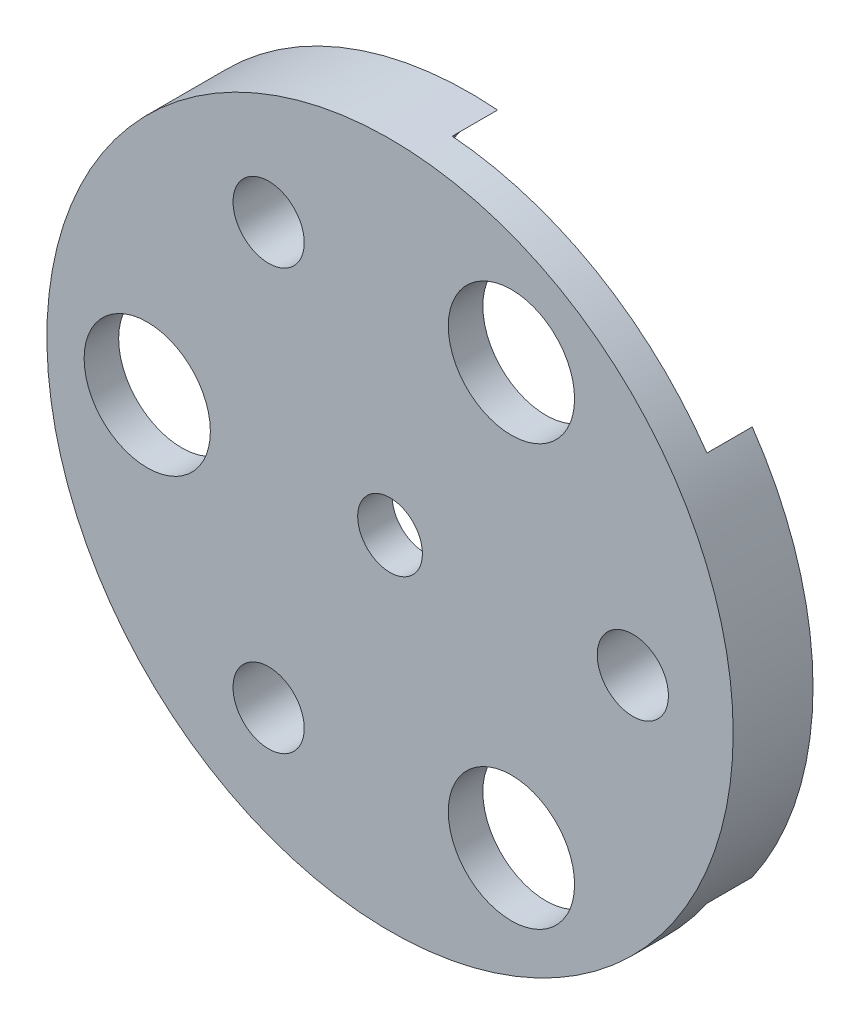
from build123d import *

# Parameters (mm, degrees)
SKETCH1_R           = 15.9
SKETCH1_R_2         = 1.65
SKETCH1_R_3         = 2.925
SKETCH1_R_4         = 1.5
BOSS_EXTRUDE1_DEPTH = 3.7
SKETCH2_R           = 2.925
CUT_EXTRUDE1_DEPTH  = 2.1


with BuildPart() as part:
    # Sketch1 → Boss-Extrude1 (new body)
    with BuildSketch(Plane.XY):
        with Locations((169.819947444, 173.617651357)):
            Circle(SKETCH1_R)
        with Locations((181.069947444, 173.617651357)):
            Circle(SKETCH1_R_2, mode=Mode.SUBTRACT)
        with Locations((158.569947444, 173.617651357)):
            Circle(SKETCH1_R_3, mode=Mode.SUBTRACT)
        with Locations((164.194947444, 163.874865564)):
            Circle(SKETCH1_R_2, mode=Mode.SUBTRACT)
        with Locations((164.194947444, 183.360437149)):
            Circle(SKETCH1_R_2, mode=Mode.SUBTRACT)
        with Locations((175.444947444, 183.360437149)):
            Circle(SKETCH1_R_3, mode=Mode.SUBTRACT)
        with Locations((175.444947444, 163.874865564)):
            Circle(SKETCH1_R_3, mode=Mode.SUBTRACT)
        with Locations((169.819947444, 173.617651357)):
            Circle(SKETCH1_R_4, mode=Mode.SUBTRACT)
    extrude(amount=BOSS_EXTRUDE1_DEPTH)

    # Sketch2 → Cut-Extrude1 (cut)
    with BuildSketch(Plane(origin=(0, 0, 0), x_dir=(-1, 0, 0), z_dir=(0, 0, -1))):
        with BuildLine():
            ThreePointArc((-155.453613863, 180.430760739), (-160.20419082, 180.929234156), (-164.29045907, 178.45559939))
            ThreePointArc((-164.29045907, 178.45559939), (-166.146359863, 179.980491692), (-168.394905731, 180.825302775))
            ThreePointArc((-168.394905731, 180.825302775), (-168.29580931, 185.600932269), (-171.10278843, 189.465815888))
            ThreePointArc((-171.10278843, 189.465815888), (-177.769947444, 187.387455277), (-182.903440038, 182.652706505))
            ThreePointArc((-182.903440038, 182.652706505), (-180.959842201, 178.28934947), (-176.774477529, 175.987354742))
            ThreePointArc((-176.774477529, 175.987354742), (-177.167122605, 173.617651357), (-176.774477529, 171.247947972))
            ThreePointArc((-176.774477529, 171.247947972), (-180.959842201, 168.945953243), (-182.903440038, 164.582596208))
            ThreePointArc((-182.903440038, 164.582596208), (-177.769947444, 159.847847437), (-171.10278843, 157.769486826))
            ThreePointArc((-171.10278843, 157.769486826), (-168.29580931, 161.634370444), (-168.394905731, 166.409999939))
            ThreePointArc((-168.394905731, 166.409999939), (-166.146359863, 167.254811021), (-164.29045907, 168.779703323))
            ThreePointArc((-164.29045907, 168.779703323), (-160.20419082, 166.306068558), (-155.453613863, 166.804541974))
            ThreePointArc((-155.453613863, 166.804541974), (-153.919947444, 173.617651357), (-155.453613863, 180.430760739))
        make_face()
        with Locations((-158.569947444, 173.617651357)):
            Circle(SKETCH2_R, mode=Mode.SUBTRACT)
        with Locations((-175.444947444, 163.874865564)):
            Circle(SKETCH2_R, mode=Mode.SUBTRACT)
        with Locations((-175.444947444, 183.360437149)):
            Circle(SKETCH2_R, mode=Mode.SUBTRACT)
    extrude(amount=-CUT_EXTRUDE1_DEPTH, mode=Mode.SUBTRACT)


solid = part.part
